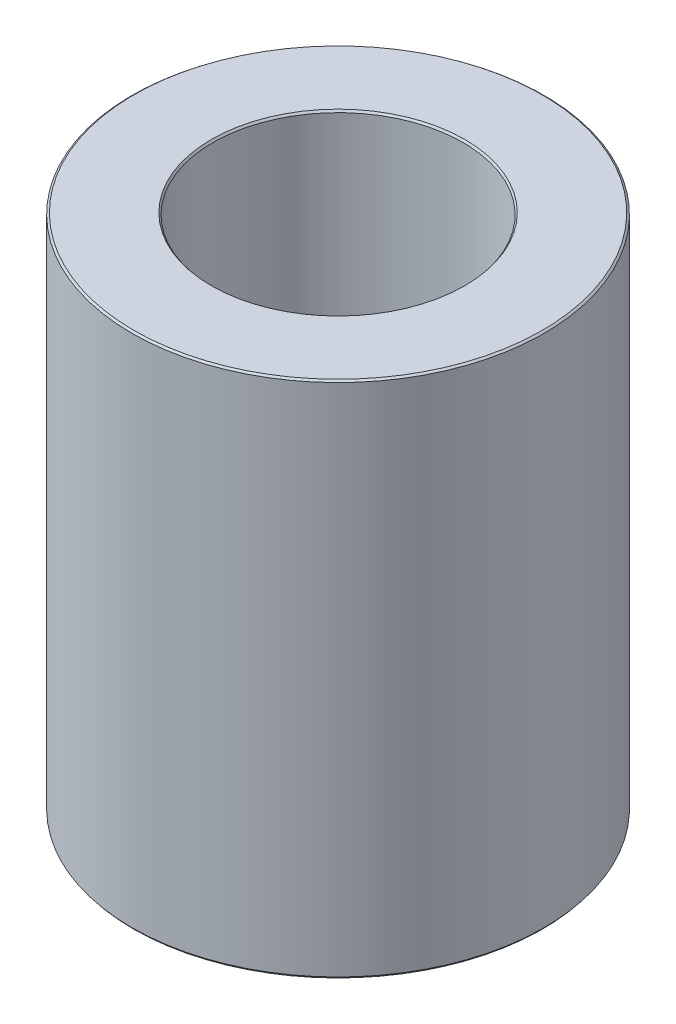
from build123d import *
from OCP.BRepFilletAPI import BRepFilletAPI_MakeChamfer

# Parameters (mm, degrees)
SKETCH1_R           = 50
BOSS_EXTRUDE1_DEPTH = 125.744711871
SKETCH2_R           = 30.381001751
CUT_EXTRUDE1_DEPTH  = 145.26272063
CHAMFER1_SIZE       = 0.367280533
CHAMFER1_SIZE2      = 0.47207031


with BuildPart() as part:
    # Sketch1 → Boss-Extrude1 (new body)
    with BuildSketch(Plane(origin=(0, 0, 0), x_dir=(1, 0, 0), z_dir=(0, 1, 0))):
        Circle(SKETCH1_R)
    extrude(amount=BOSS_EXTRUDE1_DEPTH)

    # Sketch2 → Cut-Extrude1 (cut, through all)
    with BuildSketch(Plane(origin=(0, 0, 0), x_dir=(1, 0, 0), z_dir=(0, 1, 0))):
        Circle(SKETCH2_R)
    extrude(amount=CUT_EXTRUDE1_DEPTH, mode=Mode.SUBTRACT)

    # Chamfer1: one chamfer whose edges measure the first distance from different faces: ONE call of the kernel's chamfer builder (chamfer() names one face for all edges)
    chamfer1_edges_1 = [part.edges().sort_by_distance(p)[0] for p in [
        (-30.381001751, 125.744711871, 0),
    ]]
    chamfer1_side_1 = [part.faces().sort_by_distance(p)[0] for p in [
        (-48.585786438, 125.744711871, 0),
    ]]
    chamfer1_edges_2 = [part.edges().sort_by_distance(p)[0] for p in [
        (-30.381001751, 0, 0),
    ]]
    chamfer1_side_2 = [part.faces().sort_by_distance(p)[0] for p in [
        (-30.381001751, 62.872355935, 0),
    ]]
    chamfer1_edges_3 = [part.edges().sort_by_distance(p)[0] for p in [
        (-50, 0, 0),
    ]]
    chamfer1_side_3 = [part.faces().sort_by_distance(p)[0] for p in [
        (-48.585786438, 0, 0),
    ]]
    chamfer1_edges_4 = [part.edges().sort_by_distance(p)[0] for p in [
        (-50, 125.744711871, 0),
    ]]
    chamfer1_side_4 = [part.faces().sort_by_distance(p)[0] for p in [
        (-50, 62.872355935, 0),
    ]]
    chamfer1 = BRepFilletAPI_MakeChamfer(part.part.solid().wrapped)
    for e in chamfer1_edges_1:
        chamfer1.Add(CHAMFER1_SIZE, CHAMFER1_SIZE2, e.wrapped, chamfer1_side_1[0].wrapped)  # the first distance lies on this face
    for e in chamfer1_edges_2:
        chamfer1.Add(CHAMFER1_SIZE, CHAMFER1_SIZE2, e.wrapped, chamfer1_side_2[0].wrapped)  # the first distance lies on this face
    for e in chamfer1_edges_3:
        chamfer1.Add(CHAMFER1_SIZE, CHAMFER1_SIZE2, e.wrapped, chamfer1_side_3[0].wrapped)  # the first distance lies on this face
    for e in chamfer1_edges_4:
        chamfer1.Add(CHAMFER1_SIZE, CHAMFER1_SIZE2, e.wrapped, chamfer1_side_4[0].wrapped)  # the first distance lies on this face
    add(Compound.cast(chamfer1.Shape()), mode=Mode.REPLACE)


solid = part.part
